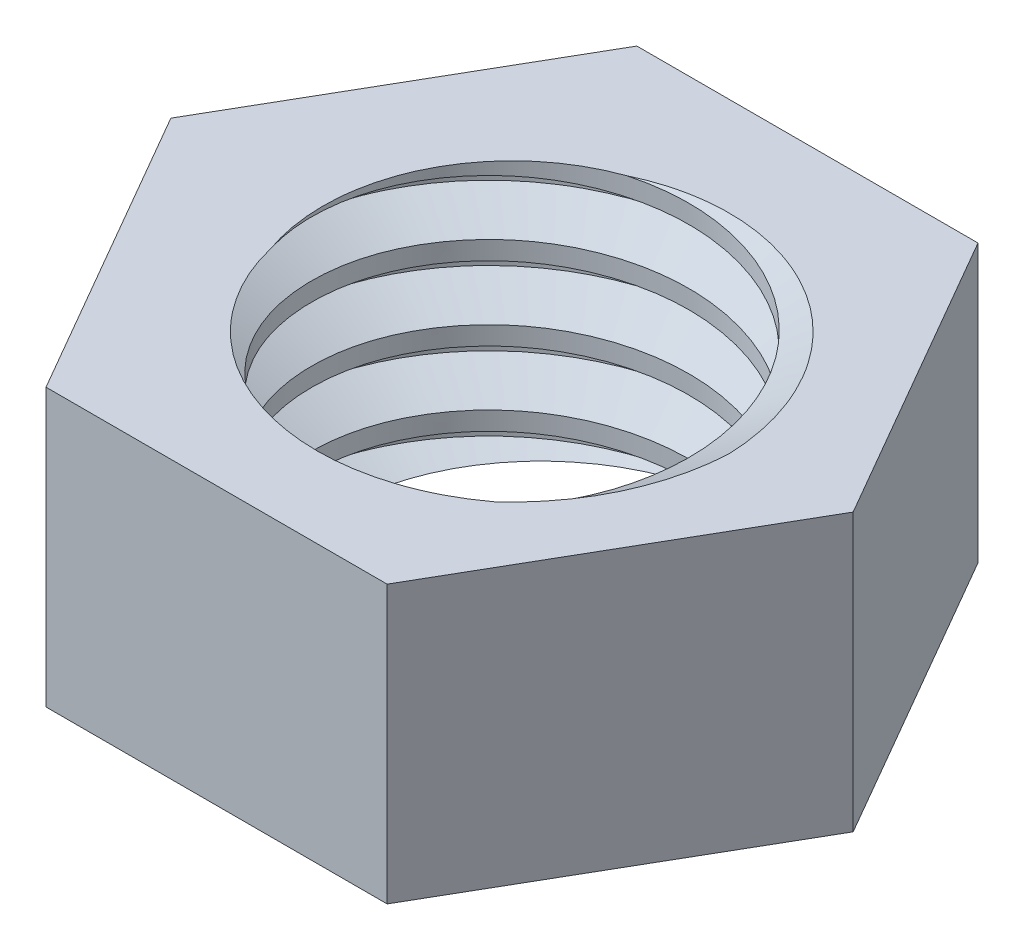
from build123d import *

# Parameters (mm, degrees)
SKETCH1_R           = 7.875
BOSS_EXTRUDE1_DEPTH = 9.525
THREAD1_PITCH       = 2.54
SKETCH25_W          = 18.30237859
SKETCH25_H          = 6.992864945
SKETCH25_W_2        = 17.991415847
SKETCH25_H_2        = 5.069715727
CUT_EXTRUDE1_DEPTH  = 29.837289258


with BuildPart() as part:
    # Sketch1 → Boss-Extrude1 (new body)
    with BuildSketch(Plane(origin=(0, 0, 0), x_dir=(1, 0, 0), z_dir=(0, 1, 0))):
        Polygon((5.865878735, 10.16), (-5.865878735, 10.16), (-11.73175747, 0), (-5.865878735, -10.16), (5.865878735, -10.16), (11.73175747, 0), align=None)
        with Locations(Location((0, 0, 0), (0, 0, 90))):
            Circle(SKETCH1_R, mode=Mode.SUBTRACT)
    extrude(amount=BOSS_EXTRUDE1_DEPTH)

    # Thread1: the profile of Thread Profile1 profile screwed along a right-hand helix of 5.937008 turns, 10 arcs to a turn; built about Z, then put on its axis
    thread1_z = Axis((0, 0, 0), (0, 0, 1))
    thread1_corners = [(7.8753, 2e-09, -0.000173205), (7.8753, 2e-09, 2.222673198), (6.500184678, 2e-09, 1.428749997), (6.500184678, 2e-09, 0.793749997)]
    with BuildLine(mode=Mode.PRIVATE) as thread1_profile:
        Line(thread1_corners[0], thread1_corners[1])
        Line(thread1_corners[1], thread1_corners[2])
        Line(thread1_corners[2], thread1_corners[3])
        Line(thread1_corners[3], thread1_corners[0])
    thread1_cap = Face(thread1_profile.wire())
    thread1_turn_angles = [0, 18, 36, 54, 72, 90, 108, 126, 144, 162, 180, 198, 216, 234, 252, 270, 288, 306, 324, 342, 360]
    thread1_turn_weights = [1, 0.9510565162951535, 1, 0.9510565162951535, 1, 0.9510565162951535, 1, 0.9510565162951535, 1, 0.9510565162951535, 1, 0.9510565162951535, 1, 0.9510565162951535, 1, 0.9510565162951535, 1, 0.9510565162951535, 1, 0.9510565162951535, 1]
    thread1_turn_rails = [Edge.make_bspline([Vector(p[0], p[1], 0).rotate(thread1_z, thread1_turn_angles[k]) / thread1_turn_weights[k] + Vector(0, 0, p[2] + THREAD1_PITCH * thread1_turn_angles[k] / 360) for k in range(21)], [0, 0, 0, 1, 1, 2, 2, 3, 3, 4, 4, 5, 5, 6, 6, 7, 7, 8, 8, 9, 9, 10, 10, 10], 2, thread1_turn_weights) for p in thread1_corners]
    thread1_turn_sides = [Face.make_surface_from_curves(thread1_turn_rails[p[0]], thread1_turn_rails[p[1]]) for p in [(0, 1), (1, 2), (2, 3), (3, 0)]]
    thread1_last_angles = [1800, 1818, 1836, 1854, 1872, 1890, 1908, 1926, 1944, 1962, 1980, 1998, 2016, 2034, 2052, 2070, 2088, 2106, 2124, 2130.661417323, 2137.322834646]
    thread1_last_weights = [1, 0.9510565162951535, 1, 0.9510565162951535, 1, 0.9510565162951535, 1, 0.9510565162951535, 1, 0.9510565162951535, 1, 0.9510565162951535, 1, 0.9510565162951535, 1, 0.9510565162951535, 1, 0.9510565162951535, 1, 0.9932489898126629, 1]
    thread1_last_rails = [Edge.make_bspline([Vector(p[0], p[1], 0).rotate(thread1_z, thread1_last_angles[k]) / thread1_last_weights[k] + Vector(0, 0, p[2] + THREAD1_PITCH * thread1_last_angles[k] / 360) for k in range(21)], [0, 0, 0, 1, 1, 2, 2, 3, 3, 4, 4, 5, 5, 6, 6, 7, 7, 8, 8, 9, 9, 10, 10, 10], 2, thread1_last_weights) for p in thread1_corners]
    thread1_last_sides = [Face.make_surface_from_curves(thread1_last_rails[p[0]], thread1_last_rails[p[1]]) for p in [(0, 1), (1, 2), (2, 3), (3, 0)]]
    thread1 = Plane(origin=(0, 13.335009906, 0), x_dir=(-0.998629535, 0, -0.052335956), z_dir=(0, -1, 0)) * Solid(Shell([*[p.moved(Location((0, 0, THREAD1_PITCH * i))) for i in range(5) for p in thread1_turn_sides], *thread1_last_sides, thread1_cap, thread1_cap.rotate(thread1_z, 2137.322834646).moved(Location((0, 0, THREAD1_PITCH * 2137.322834646 / 360)))]))
    add(thread1)

    # Sketch25 → Cut-Extrude1 (cut, through all)
    with BuildSketch(Plane(origin=(8.798818102, 0, -5.08), x_dir=(-0.49999999999999983, 0, -0.8660254037844388), z_dir=(0.8660254037844388, 0, -0.49999999999999983))):
        with Locations((-0.177692996, 13.021432472)):
            Rectangle(SKETCH25_W, SKETCH25_H)
        with Locations((-0.066634873, -2.534857864)):
            Rectangle(SKETCH25_W_2, SKETCH25_H_2)
    extrude(amount=-CUT_EXTRUDE1_DEPTH, mode=Mode.SUBTRACT)


solid = part.part
